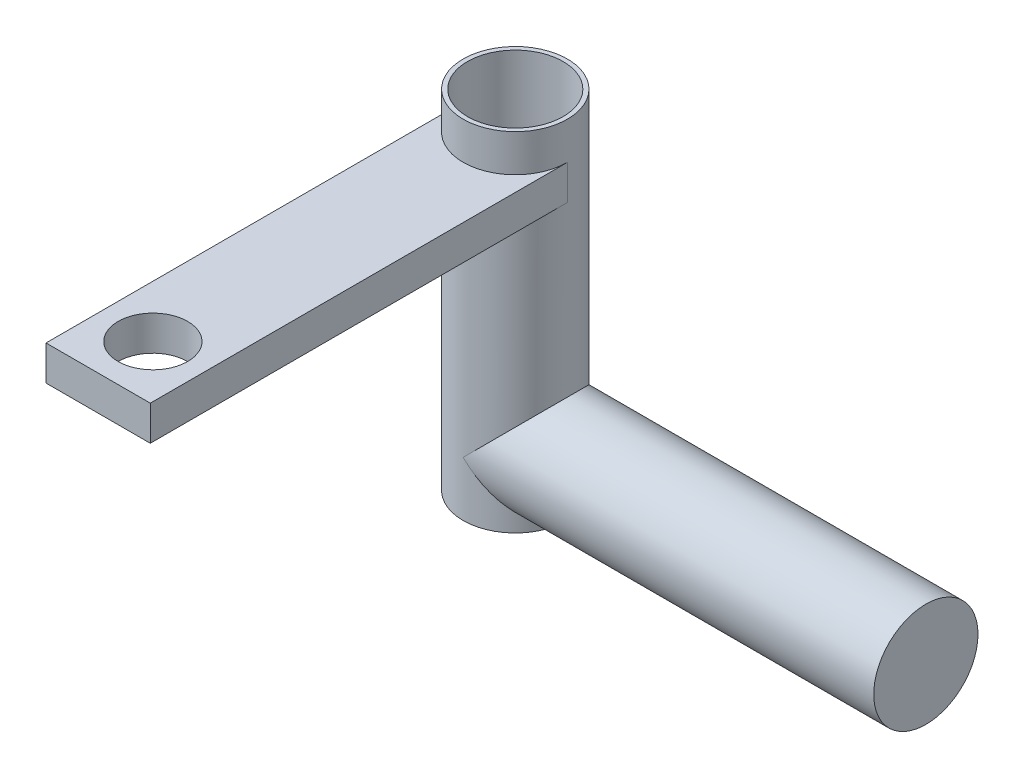
from build123d import *

# Parameters (mm, degrees)
SKETCH1_R          = 9.525
SLEEVE_DEPTH       = 63.5
SKETCH2_W          = 19.05
SKETCH2_H          = 6.35
BRACKET_DEPTH      = 76.2
SKETCH4_R          = 6.35
BRACKET_HOLE_DEPTH = 100.646453148
SKETCH5_R          = 9.525
SHAFT_DEPTH        = 75
SKETCH6_R          = 8.73125
SLEEVE_HOLE_DEPTH  = 125.353086009


with BuildPart() as part:
    # Sketch1 → Sleeve (new body)
    with BuildSketch(Plane(origin=(0, 0, 0), x_dir=(1, 0, 0), z_dir=(0, 1, 0))):
        Circle(SKETCH1_R)
    extrude(amount=SLEEVE_DEPTH)

    # Sketch2 → Bracket (add)
    with BuildSketch(Plane.XY):
        with Locations((0, 53.5)):
            Rectangle(SKETCH2_W, SKETCH2_H)
    extrude(amount=BRACKET_DEPTH)

    # Sketch4 → Bracket Hole (cut, through all)
    with BuildSketch(Plane(origin=(0, 0, 0), x_dir=(1, 0, 0), z_dir=(0, 1, 0))):
        with Locations((0, -66.2)):
            Circle(SKETCH4_R)
    extrude(amount=BRACKET_HOLE_DEPTH, mode=Mode.SUBTRACT)

    # Sketch5 → Shaft (add)
    with BuildSketch(Plane(origin=(0, 0, 0), x_dir=(0, 0, -1), z_dir=(1, 0, 0))):
        with Locations((0, 10)):
            Circle(SKETCH5_R)
    extrude(amount=SHAFT_DEPTH)

    # Sketch6 → Sleeve Hole (cut, through all)
    with BuildSketch(Plane(origin=(0, 0, 0), x_dir=(1, 0, 0), z_dir=(0, 1, 0))):
        Circle(SKETCH6_R)
    extrude(amount=SLEEVE_HOLE_DEPTH, mode=Mode.SUBTRACT)


solid = part.part
